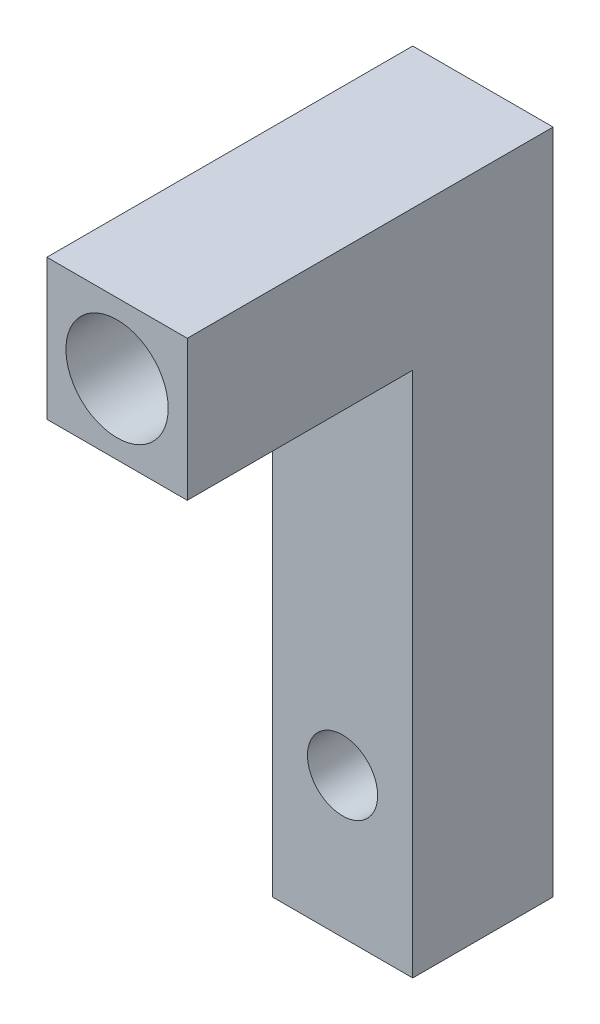
from build123d import *

# Parameters (mm, degrees)
SKETCH2_W           = 50.8
SKETCH2_H           = 50.8
BOSS_EXTRUDE1_DEPTH = 241.3
SKETCH3_R           = 12.7
CUT_EXTRUDE1_DEPTH  = 248.894110458
SKETCH4_W           = 50.8
SKETCH4_H           = 132.4
BOSS_EXTRUDE2_DEPTH = 50.8
SKETCH5_R           = 18.5
CUT_EXTRUDE2_DEPTH  = 36


with BuildPart() as part:
    # Sketch2 → Boss-Extrude1 (new body)
    with BuildSketch(Plane(origin=(0, 0, 0), x_dir=(1, 0, 0), z_dir=(0, 1, 0))):
        Rectangle(SKETCH2_W, SKETCH2_H)
    extrude(amount=BOSS_EXTRUDE1_DEPTH)

    # Sketch3 → Cut-Extrude1 (cut, through all)
    with BuildSketch(Plane.XY.offset(25.4)):
        with Locations((0, 50.8)):
            Circle(SKETCH3_R)
    extrude(amount=-CUT_EXTRUDE1_DEPTH, mode=Mode.SUBTRACT)

    # Sketch4 → Boss-Extrude2 (add)
    with BuildSketch(Plane(origin=(0, 241.3, 0), x_dir=(1, 0, 0), z_dir=(0, 1, 0))):
        with Locations((0, -40.8)):
            Rectangle(SKETCH4_W, SKETCH4_H)
    extrude(amount=-BOSS_EXTRUDE2_DEPTH)

    # Sketch5 → Cut-Extrude2 (cut)
    with BuildSketch(Plane.XY.offset(107)):
        with Locations((0, 215.9)):
            Circle(SKETCH5_R)
    extrude(amount=-CUT_EXTRUDE2_DEPTH, mode=Mode.SUBTRACT)


solid = part.part
